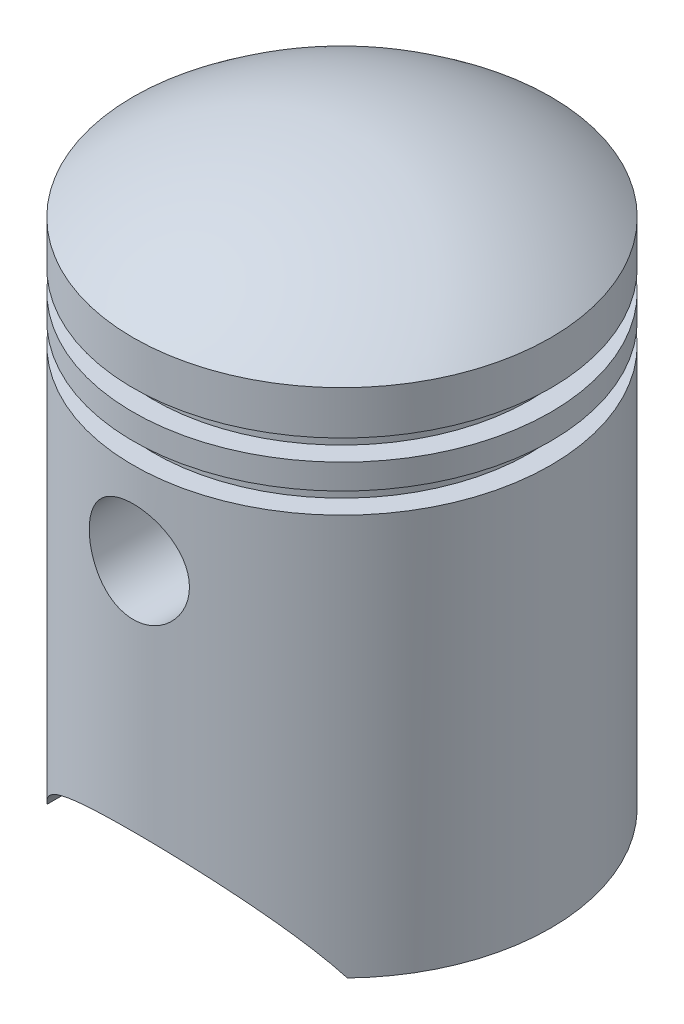
from build123d import *

# Parameters (mm, degrees)
SZKIC2_W                         = 2.5
SZKIC2_H                         = 2.5
SZYK_LINIOWY1_COUNT              = 2
SZYK_LINIOWY1_PITCH              = 5.5
WYTNIJ_WYCI_GNI_CIE1_DEPTH       = 79.421935707
WYTNIJ_WYCI_GNI_CIE1_DEPTH_BACK  = 79.421935707
WYTNIJ_WYCI_GNI_CIE2_DEPTH       = 79.421935771
WYTNIJ_WYCI_GNI_CIE2_DEPTH_BACK  = 79.421935771
SZKIC4_R                         = 6
DODANIE_WYCI_GNI_CIE1_REACH      = 90.422
DODANIE_WYCI_GNI_CIE1_END_RADIUS = 23
DODANIE_WYCI_GNI_CIE1_START      = 10
SZKIC5_R                         = 7.5
SZKIC5_R_2                       = 6


# Read off the part's stored shape, not the designer's step: Skorupa2
with BuildPart() as part:
    # Szkic1 → Obrót1 (revolve)
    with BuildSketch(Plane.XY, mode=Mode.PRIVATE) as obr_t1_sk:
        with BuildLine():
            Line((0, 0), (25, 0))
            Line((25, 0), (25, 61.224989992))
            ThreePointArc((25, 61.224989992), (13.247648854, 67.742546282), (0, 70))
            Line((0, 70), (0, 0))
        make_face()
    revolve(obr_t1_sk.sketch.rotate(Axis((0, 70, 0), (0, -1, 0)), 180), axis=Axis((0, 70, 0), (0, -1, 0)))

    # Szkic2 → Wycięcie-obrót1 (revolve, cut)
    with BuildSketch(Plane.XY):
        with Locations((23.75, 49.25)):
            Rectangle(SZKIC2_W, SZKIC2_H)
    wyci_cie_obr_t1 = revolve(axis=Axis((0, 51.36187985, 0), (0, 1, 0)), mode=Mode.SUBTRACT)

    # Szyk liniowy1: Wycięcie-obrót1 ×2
    with Locations(*[(0, i * SZYK_LINIOWY1_PITCH, 0) for i in range(1, SZYK_LINIOWY1_COUNT)]):
        add(wyci_cie_obr_t1, mode=Mode.SUBTRACT)

    # Skorupa2 outline → Skorupa2 (revolve, cut)
    with BuildSketch(Plane.XY):
        with BuildLine():
            Line((23, 0), (23, 46))
            Line((23, 46), (20.5, 46))
            Line((20.5, 46), (20.5, 58))
            Line((20.5, 58), (23, 58))
            Line((23, 58), (23.00000001, 60.248966917))
            ThreePointArc((23.00000001, 60.248966917), (12.135469854, 66.010142619), (0, 68))
            Line((0, 68), (0, 0))
            Line((0, 0), (23, 0))
        make_face()
    revolve(axis=Axis((0, 0, 0), (0, 1, 0)), mode=Mode.SUBTRACT)

    # Szkic3 → Wytnij-wyciągnięcie1 (cut, two sides: drawn at the far end of the back side and taken through both)
    with BuildSketch(Plane.XY.offset(-WYTNIJ_WYCI_GNI_CIE1_DEPTH_BACK)):
        with BuildLine():
            Line((110.085446515, -147.994467613), (18, 0))
            ThreePointArc((18, 0), (0, 10), (-18, 0))
            Line((-18, 0), (-110.085446515, -147.994467613))
            Line((-110.085446515, -147.994467613), (-110.085446515, -496.603657989))
            Line((-110.085446515, -496.603657989), (110.085446515, -496.603657989))
            Line((110.085446515, -496.603657989), (110.085446515, -147.994467613))
        make_face()
    extrude(amount=WYTNIJ_WYCI_GNI_CIE1_DEPTH + WYTNIJ_WYCI_GNI_CIE1_DEPTH_BACK, mode=Mode.SUBTRACT)

    # Szkic4 → Wytnij-wyciągnięcie2 (cut, two sides: drawn at the far end of the back side and taken through both)
    with BuildSketch(Plane.XY.offset(-WYTNIJ_WYCI_GNI_CIE2_DEPTH_BACK)):
        with Locations((0, 38)):
            Circle(SZKIC4_R)
    extrude(amount=WYTNIJ_WYCI_GNI_CIE2_DEPTH + WYTNIJ_WYCI_GNI_CIE2_DEPTH_BACK, mode=Mode.SUBTRACT)

    # Dodanie-wyciągnięcie1: up to this cylinder (the profile starts inside it)
    dodanie_wyci_gni_cie1_end = Plane(origin=(0, 38, 0), z_dir=(0, 1, 0)) * Cylinder(DODANIE_WYCI_GNI_CIE1_END_RADIUS, 227.844, mode=Mode.PRIVATE)
    # Szkic5 → Dodanie-wyciągnięcie1 (add, up to the surface)
    with BuildSketch(Plane.XY.offset(DODANIE_WYCI_GNI_CIE1_START), mode=Mode.PRIVATE) as dodanie_wyci_gni_cie1_sk1:
        with Locations(Location((0, 38, 0), (0, 0, 180))):
            Circle(SZKIC5_R)
        with Locations((0, 38)):
            Circle(SZKIC5_R_2, mode=Mode.SUBTRACT)
    dodanie_wyci_gni_cie1_tool1 = extrude(dodanie_wyci_gni_cie1_sk1.sketch, amount=DODANIE_WYCI_GNI_CIE1_REACH, mode=Mode.PRIVATE) & dodanie_wyci_gni_cie1_end
    dodanie_wyci_gni_cie1 = dodanie_wyci_gni_cie1_tool1.solids().sort_by_distance((7.287868, 38, 10))[0]
    add(dodanie_wyci_gni_cie1)

    # Lustro1: Dodanie-wyciągnięcie1 across plane
    add(dodanie_wyci_gni_cie1.mirror(Plane.XY))


solid = part.part
